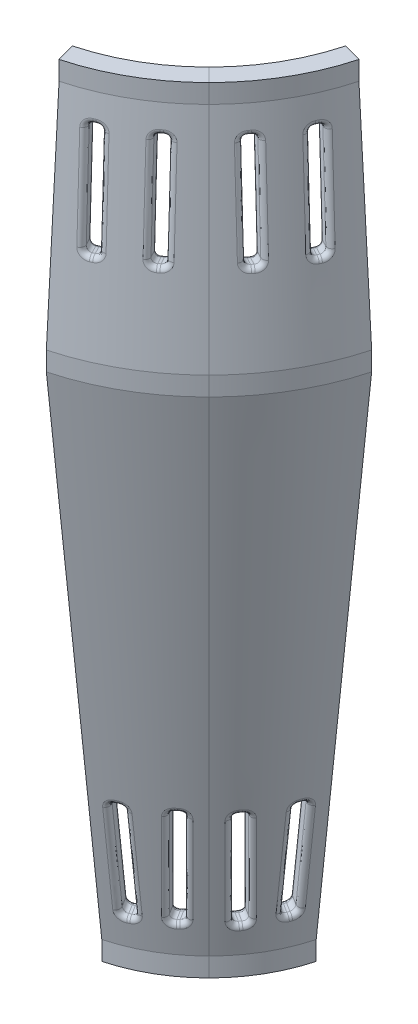
from build123d import *
from build123d.topology import SkipClean

# Parameters (mm, degrees)
BOSS_EXTRUDE1_DEPTH     = 5
BOSS_EXTRUDE2_DEPTH     = 5
BOSS_EXTRUDE3_DEPTH     = 5
CUT_EXTRUDE4_DEPTH      = 156.340276889
CUT_EXTRUDE4_DEPTH_BACK = 156.340276889
CUT_EXTRUDE5_DEPTH      = 224.650155756
CUT_EXTRUDE5_DEPTH_BACK = 224.650155756
FILLET1_R               = 1.27
CUT_EXTRUDE3_DEPTH      = 224.650155756
CUT_EXTRUDE3_DEPTH_BACK = 1
CUT_EXTRUDE6_DEPTH      = 3
CUT_EXTRUDE7_DEPTH      = 2.5
FILLET2_R               = 0.508
CIRPATTERN8_COUNT       = 2
CIRPATTERN8_ANGLE       = 330


with BuildPart() as part:
    # Sketch2 → Boss-Extrude1 (new body)
    with BuildSketch(Plane(origin=(0, 152.4, 0), x_dir=(1, 0, 0), z_dir=(0, 1, 0))):
        with BuildLine():
            Line((14.416220812, -53.802068524), (15.710316038, -58.631697656))
            ThreePointArc((15.710316038, -58.631697656), (30.35, -52.56774201), (42.921381618, -42.921381618))
            Line((42.921381618, -42.921381618), (39.385847712, -39.385847712))
            ThreePointArc((39.385847712, -39.385847712), (27.85, -48.237614991), (14.416220812, -53.802068524))
        make_face()
    extrude(amount=-BOSS_EXTRUDE1_DEPTH)


with BuildPart() as body_2:
    # Sketch1 → Boss-Extrude2 (new body)
    with BuildSketch(Plane(origin=(0, 0, 0), x_dir=(1, 0, 0), z_dir=(0, 1, 0))):
        with BuildLine():
            Line((9.058666579, -33.80740392), (10.352761804, -38.637033052))
            ThreePointArc((10.352761804, -38.637033052), (20, -34.641016151), (28.284271247, -28.284271247))
            Line((28.284271247, -28.284271247), (24.748737342, -24.748737342))
            ThreePointArc((24.748737342, -24.748737342), (17.5, -30.310889132), (9.058666579, -33.80740392))
        make_face()
    extrude(amount=BOSS_EXTRUDE2_DEPTH)


    add(part.part)  # loft4 joins it to this body
    # loft from a face of the part (loft4)
    loft([body_2.faces().sort_by_distance((18.564010231, 5, 32.153808912))[0], body_2.faces().sort_by_distance((28.786417847, 147.4, 49.85953828))[0]])



with BuildPart() as body_2_2:
    # Sketch3 → Boss-Extrude3 (new body)
    with BuildSketch(Plane(origin=(0, 215.9, 0), x_dir=(1, 0, 0), z_dir=(0, 1, 0))):
        with BuildLine():
            Line((13.186830348, -49.213920849), (14.480925573, -54.043549981))
            ThreePointArc((14.480925573, -54.043549981), (27.975, -48.454121342), (39.562624407, -39.562624407))
            Line((39.562624407, -39.562624407), (36.027090501, -36.027090501))
            ThreePointArc((36.027090501, -36.027090501), (25.475, -44.123994323), (13.186830348, -49.213920849))
        make_face()
    extrude(amount=-BOSS_EXTRUDE3_DEPTH)


with BuildPart() as body_2_1:
    add(body_2.part)

    add(body_2_2.part)  # loft6 joins it to this body
    # loft from a face of the part (loft6)
    loft([body_2_1.faces().sort_by_distance((28.786417847, 152.4, 49.85953828))[0], body_2_1.faces().sort_by_distance((26.440027474, 210.9, 45.795470938))[0]])

    # Sketch10 → Cut-Extrude4 (cut, two sides: drawn at the far end of the back side and taken through both)
    with BuildSketch(Plane(origin=(27.85, 152.4, 48.237614991), x_dir=(-0.8669702566060594, 0.04652106981836624, 0.4961838008474061), z_dir=(-0.49835988418052235, -0.08093023760196497, -0.8631846398548031)).offset(-CUT_EXTRUDE4_DEPTH_BACK)):
        Polygon((-4.955451644, 51.40393853), (-1.783911864, 51.255748034), (-3.117626326, 22.711890013), (-6.289166106, 22.860080509), align=None)
        Polygon((7.741088136, 50.810691509), (10.912627916, 50.662501013), (9.578913454, 22.118642992), (6.407373674, 22.266833488), align=None)
    extrude(amount=CUT_EXTRUDE4_DEPTH + CUT_EXTRUDE4_DEPTH_BACK, mode=Mode.SUBTRACT)

    # Sketch11 → Cut-Extrude5 (cut, two sides: drawn at the far end of the back side and taken through both)
    with BuildSketch(Plane(origin=(17.219815066, -4.393054856, 29.825594592), x_dir=(-0.8680644556170702, -0.047637093081504246, 0.494160710960497), z_dir=(-0.4959812073974541, 0.1265328717537655, -0.8590646508117471)).offset(-CUT_EXTRUDE5_DEPTH_BACK)):
        Polygon((-9.497111748, 46.126891663), (-7.062901621, 17.654089573), (-3.887901621, 17.654089573), (-6.322111748, 46.126891663), align=None)
        Polygon((1.859545004, 46.229089573), (2.168110737, 17.654089573), (5.343110737, 17.654089573), (5.034545004, 46.229089573), align=None)
    extrude(amount=CUT_EXTRUDE5_DEPTH + CUT_EXTRUDE5_DEPTH_BACK, mode=Mode.SUBTRACT)

    # Fillet1
    fillet1_edges = [body_2_1.edges().sort_by_distance(p)[0] for p in [
        (22.141583524, 27.498465035, 31.215075298),
        (21.972446336, 13.458337673, 28.806105728),
        (24.68749782, 27.703353175, 29.2820534),
        (24.895831573, 41.73585513, 31.741492552),
        (12.992899728, 27.113358117, 35.937911546),
        (13.948978083, 13.01887073, 33.367368773),
        (15.961488076, 27.210380595, 34.736982571),
        (15.029498503, 41.296366529, 37.366946241),
        (14.773475359, 40.935683996, 40.086009264),
        (17.506393683, 40.664718163, 41.655214385),
        (17.740001017, 41.033249945, 38.88150889),
        (18.425212549, 26.581844041, 39.004278506),
        (16.645181421, 12.75940729, 34.857125984),
        (16.421772012, 12.388292193, 37.648358635),
        (13.700024895, 12.656389728, 36.098638782),
        (15.48106248, 26.478585365, 40.247535704),
        (24.841565594, 41.321340984, 34.827529892),
        (27.371241512, 41.104093143, 36.030844598),
        (27.38959094, 41.525673168, 32.898165714),
        (27.175742029, 27.068559618, 33.591818937),
        (24.473190605, 13.246369061, 29.974911898),
        (24.443609454, 12.827635823, 33.088275009),
        (21.903917391, 13.047457554, 31.86747369),
        (24.605405266, 26.869903641, 35.482539765),
        (34.27259468, 175.248181673, 47.834092643),
        (32.383252767, 189.499442539, 47.740864521),
        (33.110669493, 203.728509089, 45.821224019),
        (34.974519658, 189.473725461, 45.879070432),
        (23.196952558, 175.237773794, 54.080606649),
        (21.135422618, 189.460418418, 53.679835198),
        (22.032027535, 203.717669423, 52.063329526),
        (24.076470515, 189.491503069, 52.423879583),
        (23.409619729, 175.048690478, 51.268860142),
        (21.581103253, 189.086272508, 48.101776702),
        (22.247837484, 203.529066081, 49.256594266),
        (19.527164226, 203.310976748, 47.725916676),
        (19.29322782, 203.495778891, 50.489060211),
        (18.621702581, 189.05220761, 49.325944379),
        (20.463595268, 175.016797467, 52.516196094),
        (20.693842968, 174.831356241, 49.746093812),
        (34.304832159, 175.030452114, 44.719137659),
        (32.468690581, 189.066796027, 41.538847156),
        (33.138156257, 203.510033021, 42.69839572),
        (30.613240083, 203.322877977, 41.494615759),
        (30.558050131, 203.537562646, 44.579520822),
        (29.892528426, 189.094965944, 43.426803416),
        (31.717660797, 175.056834393, 46.588025412),
        (31.776272824, 174.842738308, 43.509514878),
    ]]
    fillet(fillet1_edges, radius=FILLET1_R)

    # Sketch9 → Cut-Extrude3 (cut, two sides: drawn at the far end of the back side and taken through both)
    with BuildSketch(Plane(origin=(17.219815066, -4.393054856, 29.825594592), x_dir=(-0.8680644556170702, -0.047637093081504246, 0.494160710960497), z_dir=(-0.4959812073974541, 0.1265328717537655, -0.8590646508117471)).offset(-CUT_EXTRUDE3_DEPTH_BACK)):
        with BuildLine():
            Line((-2.928143347, 171.089965331), (9.771856653, 171.700562973))
            Line((9.771856653, 171.700562973), (9.915925901, 168.704024294))
            Line((9.915925901, 168.704024294), (-2.784074099, 168.093426653))
            ThreePointArc((-2.784074099, 168.093426653), (-7.877379193, 163.84392748), (-13.354868949, 167.585198116))
            Line((-13.354868949, 167.585198116), (-26.054868949, 166.974600475))
            Line((-26.054868949, 166.974600475), (-26.198938197, 169.971139153))
            Line((-26.198938197, 169.971139153), (-13.498938197, 170.581736795))
            ThreePointArc((-13.498938197, 170.581736795), (-8.405633103, 174.831235968), (-2.928143347, 171.089965331))
        make_face()
        with BuildLine():
            Line((-11.523076023, 129.485198116), (-24.223076023, 128.874600475))
            Line((-24.223076023, 128.874600475), (-24.367145271, 131.871139153))
            Line((-24.367145271, 131.871139153), (-11.667145271, 132.481736795))
            ThreePointArc((-11.667145271, 132.481736795), (-6.573840177, 136.731235968), (-1.096350422, 132.989965331))
            Line((-1.096350422, 132.989965331), (11.603649578, 133.600562973))
            Line((11.603649578, 133.600562973), (11.747718826, 130.604024294))
            Line((11.747718826, 130.604024294), (-0.952281174, 129.993426653))
            ThreePointArc((-0.952281174, 129.993426653), (-6.045586268, 125.74392748), (-11.523076023, 129.485198116))
        make_face()
        with BuildLine():
            Line((-9.691283098, 91.385198116), (-22.391283098, 90.774600475))
            Line((-22.391283098, 90.774600475), (-22.535352346, 93.771139153))
            Line((-22.535352346, 93.771139153), (-9.835352346, 94.381736795))
            ThreePointArc((-9.835352346, 94.381736795), (-4.742047252, 98.631235968), (0.735442504, 94.889965331))
            Line((0.735442504, 94.889965331), (13.435442504, 95.500562973))
            Line((13.435442504, 95.500562973), (13.579511752, 92.504024294))
            Line((13.579511752, 92.504024294), (0.879511752, 91.893426653))
            ThreePointArc((0.879511752, 91.893426653), (-4.213793342, 87.64392748), (-9.691283098, 91.385198116))
        make_face()
        with BuildLine():
            Line((-7.859490172, 53.285198116), (-20.559490172, 52.674600475))
            Line((-20.559490172, 52.674600475), (-20.70355942, 55.671139153))
            Line((-20.70355942, 55.671139153), (-8.00355942, 56.281736795))
            ThreePointArc((-8.00355942, 56.281736795), (-2.910254326, 60.531235968), (2.56723543, 56.789965331))
            Line((2.56723543, 56.789965331), (15.26723543, 57.400562973))
            Line((15.26723543, 57.400562973), (15.411304678, 54.404024294))
            Line((15.411304678, 54.404024294), (2.711304678, 53.793426653))
            ThreePointArc((2.711304678, 53.793426653), (-2.382000416, 49.54392748), (-7.859490172, 53.285198116))
        make_face()
    extrude(amount=CUT_EXTRUDE3_DEPTH + CUT_EXTRUDE3_DEPTH_BACK, mode=Mode.SUBTRACT)

    # Sketch12 → Cut-Extrude6 (cut)
    with BuildSketch(Plane(origin=(17.219815066, -4.393054856, 29.825594592), x_dir=(-0.868333255097698, -0.07227401016771931, 0.4906870953527438), z_dir=(-0.495981207397454, 0.1265328717537655, -0.8590646508117471))):
        with BuildLine():
            Line((-27.421992441, 128.232033401), (-14.741115566, 129.158419486))
            ThreePointArc((-14.741115566, 129.158419486), (-9.172238168, 125.554587564), (-4.186237775, 129.929493286))
            Line((-4.186237775, 129.929493286), (8.494639099, 130.855879372))
            Line((8.494639099, 130.855879372), (8.276060223, 133.847905988))
            Line((8.276060223, 133.847905988), (-4.404816652, 132.921519903))
            ThreePointArc((-4.404816652, 132.921519903), (-9.97369405, 136.525351825), (-14.959694443, 132.150446103))
            Line((-14.959694443, 132.150446103), (-27.640571318, 131.224060017))
            Line((-27.640571318, 131.224060017), (-27.421992441, 128.232033401))
        make_face()
    extrude(amount=-CUT_EXTRUDE6_DEPTH, mode=Mode.SUBTRACT)

    # Sketch13 → Cut-Extrude7 (cut)
    with SkipClean():  # the faces are left unmerged after this step: merging them gives an invalid solid
        with BuildSketch(Plane(origin=(17.219815066, -4.393054856, 29.825594592), x_dir=(-0.8680644556170702, -0.047637093081504246, 0.494160710960497), z_dir=(-0.4959812073974541, 0.1265328717537655, -0.8590646508117471))):
            with BuildLine():
                Line((-20.559490172, 52.674600475), (-7.859490172, 53.285198116))
                ThreePointArc((-7.859490172, 53.285198116), (-2.382000416, 49.54392748), (2.711304678, 53.793426653))
                Line((2.711304678, 53.793426653), (15.411304678, 54.404024294))
                Line((15.411304678, 54.404024294), (15.26723543, 57.400562973))
                Line((15.26723543, 57.400562973), (2.56723543, 56.789965331))
                ThreePointArc((2.56723543, 56.789965331), (-2.910254326, 60.531235968), (-8.00355942, 56.281736795))
                Line((-8.00355942, 56.281736795), (-20.70355942, 55.671139153))
                Line((-20.70355942, 55.671139153), (-20.559490172, 52.674600475))
            make_face()
            with BuildLine():
                Line((-22.391283098, 90.774600475), (-9.691283098, 91.385198116))
                ThreePointArc((-9.691283098, 91.385198116), (-4.213793342, 87.64392748), (0.879511752, 91.893426653))
                Line((0.879511752, 91.893426653), (13.579511752, 92.504024294))
                Line((13.579511752, 92.504024294), (13.435442504, 95.500562973))
                Line((13.435442504, 95.500562973), (0.735442504, 94.889965331))
                ThreePointArc((0.735442504, 94.889965331), (-4.742047252, 98.631235968), (-9.835352346, 94.381736795))
                Line((-9.835352346, 94.381736795), (-22.535352346, 93.771139153))
                Line((-22.535352346, 93.771139153), (-22.391283098, 90.774600475))
            make_face()
        extrude(amount=-CUT_EXTRUDE7_DEPTH, mode=Mode.SUBTRACT)
    add(body_2_1.part.scale(1), mode=Mode.REPLACE)  # the faces are merged on a copy

    # Fillet2
    fillet2_edges = [body_2_1.edges().sort_by_distance(p)[0] for p in [
        (31.877278905, 86.659633911, 34.361020277),
        (29.575430448, 89.550140984, 36.901206824),
        (23.92810734, 93.440819832, 41.444697642),
        (23.136793668, 82.553566992, 40.074102158),
        (17.169667316, 89.550140984, 44.063677508),
        (13.818877008, 86.659633911, 44.787043474),
        (13.350682108, 48.857777557, 39.162258003),
        (13.516303981, 51.827379224, 39.561858122),
        (21.184118589, 55.687776523, 36.691969709),
        (27.503422164, 51.827379224, 31.486391674),
        (27.240169246, 48.857777557, 31.143158865),
        (20.392804917, 44.800523684, 35.321374224),
        (17.27985757, 124.380198795, 49.419821983),
        (25.88078242, 120.306610301, 44.826830091),
        (34.158892502, 124.380198795, 39.674706621),
        (34.639784068, 127.356599009, 39.830742893),
        (26.672096092, 131.193863141, 46.197425576),
        (17.174543163, 127.356599009, 49.914304432),
        (35.319693405, 165.562197964, 41.678476627),
        (35.470892566, 162.506474209, 41.87556687),
        (18.529858424, 162.506474209, 51.656477492),
        (27.609714508, 158.318611072, 47.82142831),
        (18.434772847, 165.562197964, 51.426990056),
        (27.154803146, 169.523796184, 47.033498719),
    ]]
    fillet(fillet2_edges, radius=FILLET2_R)


with BuildPart() as cirpattern8_1:
    # CirPattern8: pattern copy
    add(body_2_1.part.rotate(Axis((0, 215.9, 0), (0, -1, 0)), 1 * CIRPATTERN8_ANGLE / (CIRPATTERN8_COUNT - 1)))


solid = Compound([body_2_1.part, cirpattern8_1.part])
